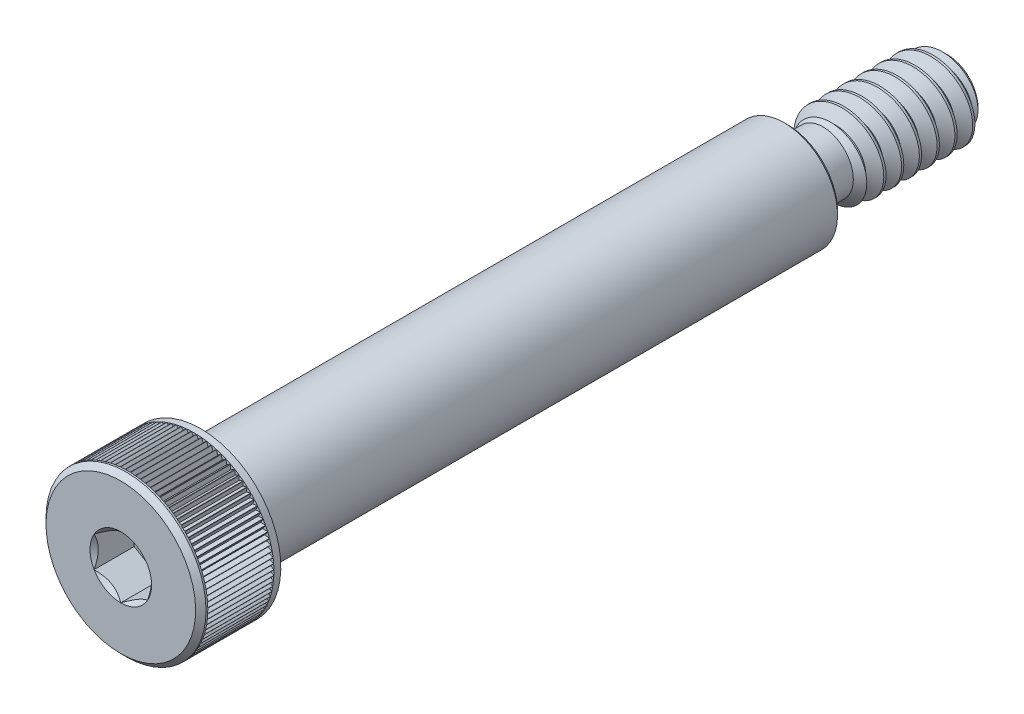
from build123d import *

# Parameters (mm, degrees)
CHAMFER1_SIZE      = 0.60325
CHAMFER2_SIZE      = 0.3095625
CHAMFER3_SIZE      = 0.2032
CUT_EXTRUDE5_DEPTH = 1.968103125
CIRPATTERN1_COUNT  = 99
CUT_EXTRUDE2_DEPTH = 2.38125
CUT_SWEEP1_PITCH   = 1.058333333


with BuildPart() as part:
    # Sketch1 → Revolve1 (revolve)
    with BuildSketch(Plane(origin=(0, 0, 0), x_dir=(0, 0, -1), z_dir=(1, 0, 0))):
        Polygon((0, 4.7625), (4.7625, 4.7625), (4.7625, 3.175), (39.6875, 3.175), (39.6875, 2.413), (49.2125, 2.413), (49.2125, 0), (0, 0), align=None)
    revolve(axis=Axis((0, 0, -49.2125), (0, 0, 1)))

    # Sketch5 → Cut-Revolve1 (revolve, cut)
    with BuildSketch(Plane(origin=(0, 0, 0), x_dir=(0, 0, -1), z_dir=(1, 0, 0))):
        with BuildLine():
            Line((39.6875, 3.175), (43.1673, 3.175))
            Line((43.1673, 3.175), (41.7957, 1.8034))
            Line((41.7957, 1.8034), (40.2971, 1.8034))
            ThreePointArc((40.2971, 1.8034), (39.866047706, 1.981947706), (39.6875, 2.413))
            Line((39.6875, 2.413), (39.6875, 3.175))
        make_face()
    revolve(axis=Axis((0, 0, -49.2125), (0, 0, 1)), mode=Mode.SUBTRACT)

    # Chamfer1
    chamfer1_edges = [part.edges().sort_by_distance(p)[0] for p in [
        (0, -2.413, -49.2125),
    ]]
    chamfer(chamfer1_edges, length=CHAMFER1_SIZE)

    # Chamfer2
    chamfer2_edges = [part.edges().sort_by_distance(p)[0] for p in [
        (0, -4.7625, 0),
    ]]
    chamfer(chamfer2_edges, length=CHAMFER2_SIZE)

    # Chamfer3
    chamfer3_edges = [part.edges().sort_by_distance(p)[0] for p in [
        (0, -3.175, -39.6875),
    ]]
    chamfer(chamfer3_edges, length=CHAMFER3_SIZE)

    # Sketch11 → Cut-Extrude5 (cut, symmetric)
    with BuildSketch(Plane.XY.offset(-2.38125)):
        Polygon((0, 4.51485), (0.142980794, 4.7625), (-0.142980794, 4.7625), align=None)
    cut_extrude5 = extrude(amount=CUT_EXTRUDE5_DEPTH, both=True, mode=Mode.SUBTRACT)

    # CirPattern1: Cut-Extrude5 ×99 about axis
    cirpattern1_axis = Axis((0, 0, 0), (0, 0, 1))
    for i in range(1, CIRPATTERN1_COUNT):
        add(cut_extrude5.rotate(cirpattern1_axis, i * 360 / CIRPATTERN1_COUNT), mode=Mode.SUBTRACT)

    # Sketch8 → Cut-Extrude2 (cut)
    with BuildSketch(Plane.XY):
        Polygon((1.5875, 0.916543552), (0, 1.833087105), (-1.5875, 0.916543552), (-1.5875, -0.916543552), (0, -1.833087105), (1.5875, -0.916543552), align=None)
    extrude(amount=-CUT_EXTRUDE2_DEPTH, mode=Mode.SUBTRACT)

    # Cut-Extrude4 cone 1 section (through the dimple's axis) → Cut-Extrude4 (revolve, cut)
    with BuildSketch(Plane(origin=(0, 0, 0), x_dir=(0, -1, 0), z_dir=(1, 0, 0))):
        Polygon((0, 0), (1.833087105, 0), (0, 1.833087105), align=None)
    revolve(axis=Axis((0, 0, 0), (0, 0, -1)), mode=Mode.SUBTRACT)

    # Cut-Sweep1: the profile of Sketch4 screwed along a right-hand helix of 10 turns, 8 arcs to a turn; built about Z, then put on its axis
    cut_sweep1_z = Axis((0, 0, 0), (0, 0, 1))
    cut_sweep1_corners = [(2.470283972, 0, 0.033072917), (2.470283972, 0, -0.959114583), (1.725592336, 0, -0.529166667), (1.725592336, 0, -0.396875)]
    with BuildLine(mode=Mode.PRIVATE) as cut_sweep1_profile:
        Line(cut_sweep1_corners[0], cut_sweep1_corners[1])
        Line(cut_sweep1_corners[1], cut_sweep1_corners[2])
        Line(cut_sweep1_corners[2], cut_sweep1_corners[3])
        Line(cut_sweep1_corners[3], cut_sweep1_corners[0])
    cut_sweep1_cap = Face(cut_sweep1_profile.wire())
    cut_sweep1_turn_angles = [0, 22.5, 45, 67.5, 90, 112.5, 135, 157.5, 180, 202.5, 225, 247.5, 270, 292.5, 315, 337.5, 360]
    cut_sweep1_turn_weights = [1, 0.9238795325112867, 1, 0.9238795325112867, 1, 0.9238795325112867, 1, 0.9238795325112867, 1, 0.9238795325112867, 1, 0.9238795325112867, 1, 0.9238795325112867, 1, 0.9238795325112867, 1]
    cut_sweep1_turn_rails = [Edge.make_bspline([Vector(p[0], p[1], 0).rotate(cut_sweep1_z, cut_sweep1_turn_angles[k]) / cut_sweep1_turn_weights[k] + Vector(0, 0, p[2] + CUT_SWEEP1_PITCH * cut_sweep1_turn_angles[k] / 360) for k in range(17)], [0, 0, 0, 1, 1, 2, 2, 3, 3, 4, 4, 5, 5, 6, 6, 7, 7, 8, 8, 8], 2, cut_sweep1_turn_weights) for p in cut_sweep1_corners]
    cut_sweep1_turn_sides = [Face.make_surface_from_curves(cut_sweep1_turn_rails[p[0]], cut_sweep1_turn_rails[p[1]]) for p in [(0, 1), (1, 2), (2, 3), (3, 0)]]
    cut_sweep1 = Plane(origin=(0, 0, -49.2125), x_dir=(0, 1, 0), z_dir=(0, 0, 1)) * Solid(Shell([*[p.moved(Location((0, 0, CUT_SWEEP1_PITCH * i))) for i in range(10) for p in cut_sweep1_turn_sides], cut_sweep1_cap, cut_sweep1_cap.rotate(cut_sweep1_z, 3600).moved(Location((0, 0, CUT_SWEEP1_PITCH * 3600 / 360)))]))
    add(cut_sweep1, mode=Mode.SUBTRACT)

    # Sketch12 → Revolve2 (revolve)
    with BuildSketch(Plane(origin=(0, 0, 0), x_dir=(0, 0, -1), z_dir=(1, 0, 0))):
        with BuildLine():
            Line((39.6875, 2.9718), (39.4843, 3.175))
            Line((39.4843, 3.175), (4.7625, 3.175))
            Line((4.7625, 3.175), (4.7625, 0))
            Line((4.7625, 0), (39.6875, 0))
            Line((39.6875, 0), (41.7957, 0))
            Line((41.7957, 0), (41.7957, 1.8034))
            Line((41.7957, 1.8034), (40.2971, 1.8034))
            ThreePointArc((40.2971, 1.8034), (39.866047706, 1.981947706), (39.6875, 2.413))
            Line((39.6875, 2.413), (39.6875, 2.9718))
        make_face()
    revolve(axis=Axis((0, 0, -4.7625), (0, 0, -1)))


solid = part.part
